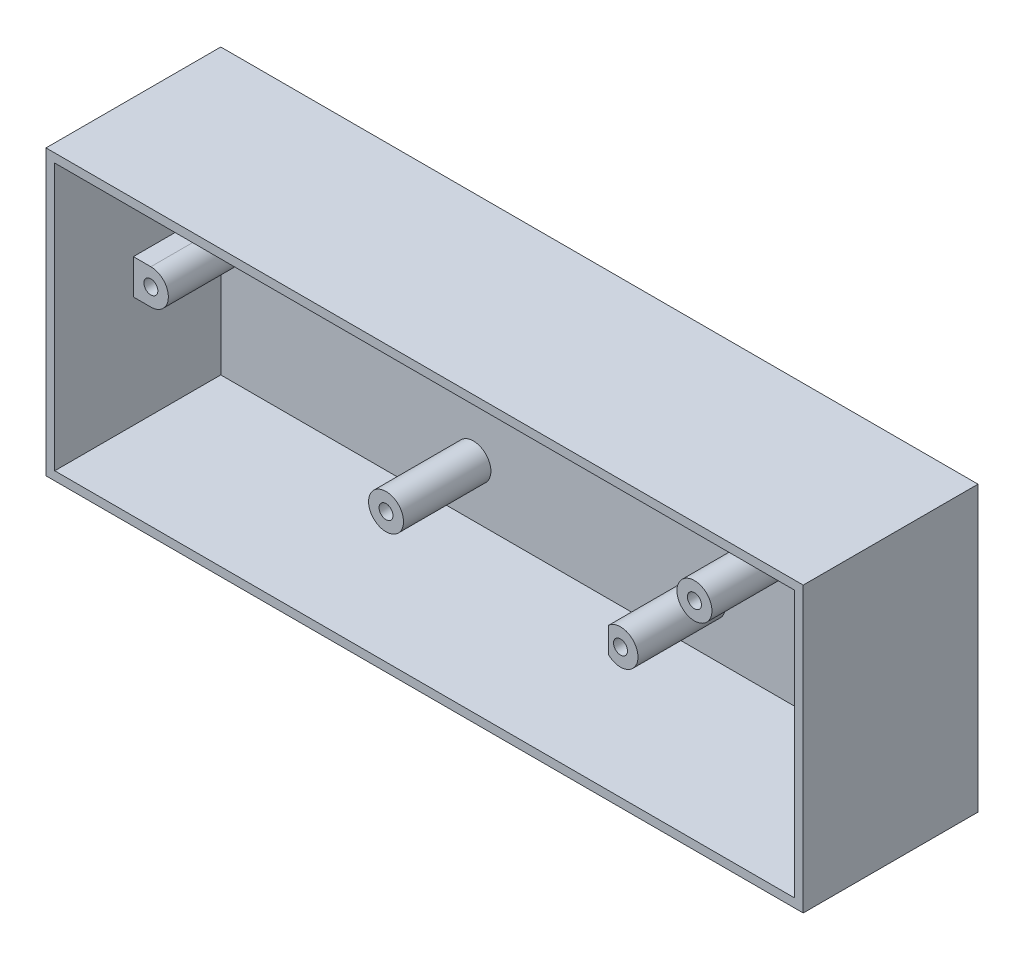
from build123d import *

# Parameters (mm, degrees)
SKETCH1_W           = 173.3
SKETCH1_H           = 65
BOSS_EXTRUDE1_DEPTH = 60
SHELL1_T            = 2
SKETCH3_W           = 219.37101133
SKETCH3_H           = 94.638771208
CUT_EXTRUDE3_DEPTH  = 20
SKETCH5_R           = 4
BOSS_EXTRUDE2_DEPTH = 20
SKETCH6_R           = 1.6
CUT_EXTRUDE5_DEPTH  = 4


with BuildPart() as part:
    # Sketch1 → Boss-Extrude1 (new body)
    with BuildSketch(Plane.XY):
        with Locations((16.522205438, 29.735649547)):
            Rectangle(SKETCH1_W, SKETCH1_H)
    extrude(amount=BOSS_EXTRUDE1_DEPTH)

    # Shell1 (no face opened: a closed hollow body)
    add(offset(amount=-SHELL1_T, mode=Mode.PRIVATE), mode=Mode.SUBTRACT)

    # Sketch3 → Cut-Extrude3 (cut)
    with BuildSketch(Plane.XY.offset(60)):
        with Locations((3.172205438, 21.820567217)):
            Rectangle(SKETCH3_W, SKETCH3_H)
    extrude(amount=-CUT_EXTRUDE3_DEPTH, mode=Mode.SUBTRACT)

    # Sketch5 → Boss-Extrude2 (add)
    with BuildSketch(Plane.XY.offset(2)):
        with Locations((-10.307794562, 11.055649547)):
            Circle(SKETCH5_R)
        with Locations((60.272205438, 28.685649547)):
            Circle(SKETCH5_R)
        with BuildLine():
            Line((-68.127794562, 60.235649547), (-60.127794562, 60.235649547))
            Line((-60.127794562, 60.235649547), (-60.127794562, 56.235649547))
            ThreePointArc((-60.127794562, 56.235649547), (-61.299367437, 53.407222422), (-64.127794562, 52.235649547))
            Line((-64.127794562, 52.235649547), (-68.127794562, 52.235649547))
            Line((-68.127794562, 52.235649547), (-68.127794562, 60.235649547))
        make_face()
        with BuildLine():
            Line((101.172205438, 60.235649547), (93.172205438, 60.235649547))
            Line((93.172205438, 60.235649547), (93.172205438, 56.235649547))
            ThreePointArc((93.172205438, 56.235649547), (94.343778313, 53.407222422), (97.172205438, 52.235649547))
            Line((97.172205438, 52.235649547), (101.172205438, 52.235649547))
            Line((101.172205438, 52.235649547), (101.172205438, 60.235649547))
        make_face()
        with BuildLine():
            Line((-31.227794562, 60.235649547), (-15.727794562, 60.235649547))
            Line((-15.727794562, 60.235649547), (-15.727794562, 56.235649547))
            ThreePointArc((-15.727794562, 56.235649547), (-16.899367437, 53.407222422), (-19.727794562, 52.235649547))
            Line((-19.727794562, 52.235649547), (-27.227794562, 52.235649547))
            ThreePointArc((-27.227794562, 52.235649547), (-30.056221687, 53.407222422), (-31.227794562, 56.235649547))
            Line((-31.227794562, 56.235649547), (-31.227794562, 60.235649547))
        make_face()
        with BuildLine():
            Line((56.272205438, 60.235649547), (64.272205438, 60.235649547))
            Line((64.272205438, 60.235649547), (64.272205438, 56.235649547))
            ThreePointArc((64.272205438, 56.235649547), (60.272205438, 52.235649547), (56.272205438, 56.235649547))
            Line((56.272205438, 56.235649547), (56.272205438, 60.235649547))
        make_face()
        with BuildLine():
            Line((-68.127794562, 32.685649547), (-64.127794562, 32.685649547))
            ThreePointArc((-64.127794562, 32.685649547), (-60.127794562, 28.685649547), (-64.127794562, 24.685649547))
            Line((-64.127794562, 24.685649547), (-68.127794562, 24.685649547))
            Line((-68.127794562, 24.685649547), (-68.127794562, 32.685649547))
        make_face()
        with BuildLine():
            Line((40.552205438, 13.912220918), (40.552205438, 8.199078175))
            ThreePointArc((40.552205438, 8.199078175), (47.352205438, 11.055649547), (40.552205438, 13.912220918))
        make_face()
    extrude(amount=BOSS_EXTRUDE2_DEPTH)

    # Sketch6 → Cut-Extrude5 (cut)
    with BuildSketch(Plane.XY.offset(22)):
        with Locations((-64.127794562, 56.235649547)):
            Circle(SKETCH6_R)
        with Locations((-27.227794562, 56.235649547)):
            Circle(SKETCH6_R)
        with Locations((-19.727794562, 56.235649547)):
            Circle(SKETCH6_R)
        with Locations((60.272205438, 56.235649547)):
            Circle(SKETCH6_R)
        with Locations((97.172205438, 56.235649547)):
            Circle(SKETCH6_R)
        with Locations((-64.127794562, 28.685649547)):
            Circle(SKETCH6_R)
        with Locations((-10.307794562, 11.055649547)):
            Circle(SKETCH6_R)
        with Locations((43.352205438, 11.055649547)):
            Circle(SKETCH6_R)
        with Locations((60.272205438, 28.685649547)):
            Circle(SKETCH6_R)
    extrude(amount=-CUT_EXTRUDE5_DEPTH, mode=Mode.SUBTRACT)


solid = part.part
